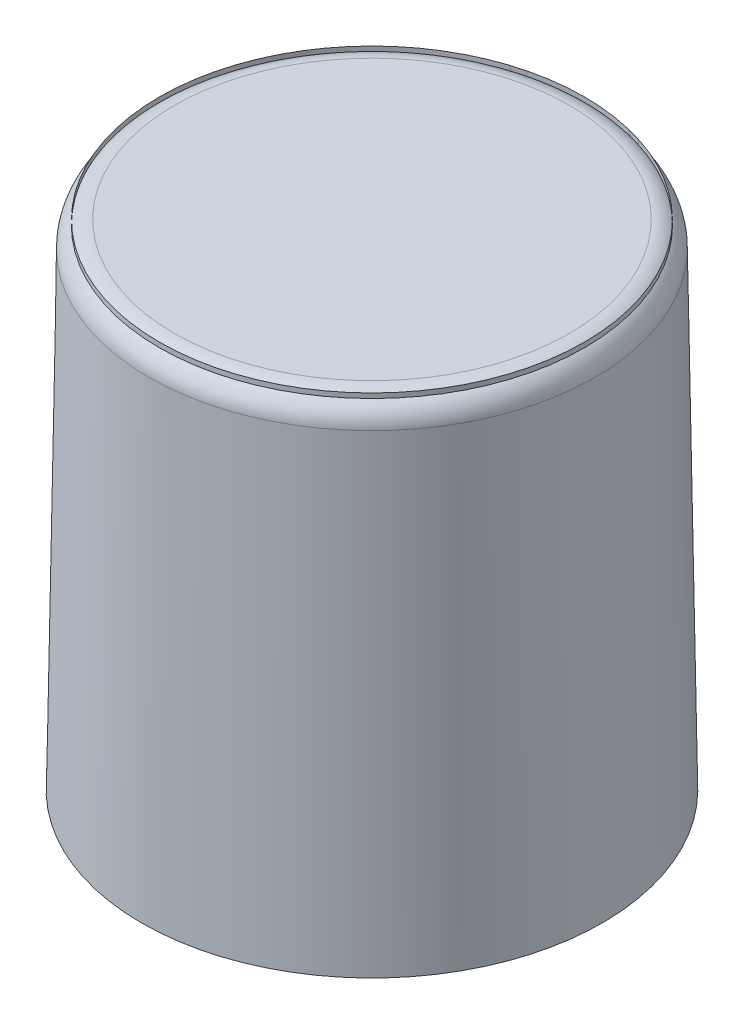
from build123d import *

# Parameters (mm, degrees)
SKETCH3_R           = 41.5
BOSS_EXTRUDE1_DEPTH = 2.5
FILLET1_R           = 5


# Read off the part's stored shape, not the designer's step: Loft-Thin1
with BuildPart() as part:
    # Loft-Thin1 outline → Loft-Thin1 (revolve)
    with BuildSketch(Plane.XY):
        Polygon((43.5, 96.5), (41.499758397, 96.5), (42.999758397, 0), (45, 0), align=None)
    revolve(axis=Axis((0, 0, 0), (0, 1, 0)))

    # Sketch3 → Boss-Extrude1 (add)
    with BuildSketch(Plane(origin=(0, 96.5, 0), x_dir=(1, 0, 0), z_dir=(0, 1, 0))):
        with Locations(Location((0, 0, 0), (0, 0, 270))):
            Circle(SKETCH3_R)
    extrude(amount=-BOSS_EXTRUDE1_DEPTH)

    # Fillet1
    fillet1_edges = [part.edges().sort_by_distance(p)[0] for p in [
        (-43.5, 96.5, 0),
    ]]
    fillet(fillet1_edges, radius=FILLET1_R)


solid = part.part
